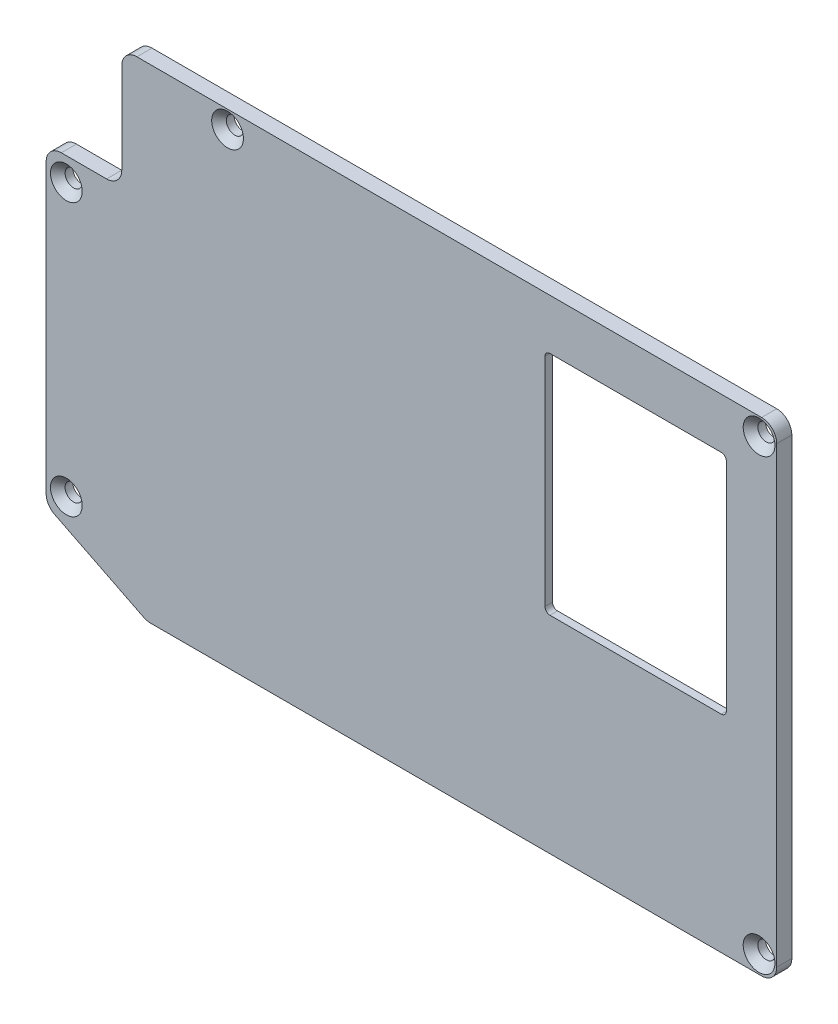
from build123d import *

# Parameters (mm, degrees)
EXTRUDE_1_DEPTH             = 3
HOLE_WIZARD_M3_1_AT_2_COUNT = 2
HOLE_WIZARD_M3_1_AT_2_PITCH = 89
HOLE_WIZARD_M3_1_AT_3_COUNT = 2
HOLE_WIZARD_M3_1_AT_3_PITCH = 139.767316539
HOLE_WIZARD_M3_1_AT_4_COUNT = 2
HOLE_WIZARD_M3_1_AT_4_PITCH = 158.615198724
HOLE_WIZARD_M3_1_AT_5_COUNT = 2
HOLE_WIZARD_M3_1_AT_5_PITCH = 105.5
FILLET_1_R                  = 3
FILLET_2_R                  = 3
CUT_EXTRUDE_1_DEPTH         = 1.2
SKETCH_5_W                  = 15
SKETCH_5_H                  = 88
CUT_EXTRUDE_2_DEPTH         = 0.8
FILLET_5_R                  = 3
FILLET_6_R                  = 5
FILLET_7_R                  = 3
SKETCH_6_W                  = 1
SKETCH_6_H                  = 16
SKETCH_6_H_2                = 12
SKETCH_6_W_2                = 12
SKETCH_6_H_3                = 1
EXTRUDE_2_DEPTH             = 1
FILLET_8_R                  = 3
CHAMFER_1_SIZE              = 1
EXTRUDE_4_DEPTH             = 1.2
CUT_EXTRUDE_3_DEPTH         = 10
CUT_EXTRUDE_5_DEPTH         = 1.5
CUT_EXTRUDE_6_DEPTH         = 0.4
FILLET_9_R                  = 2
FILLET_10_R                 = 4


with BuildPart() as part:
    # 草图1 → 凸台-拉伸1 (new body)
    with BuildSketch(Plane.XY):
        Polygon((15, 96), (15, 72), (0, 72), (0, 10), (20, 0), (145, 0), (145, 96), align=None)
    extrude(amount=EXTRUDE_1_DEPTH)

    # 草图2 → M3 平头机械螺钉的锥形沉头孔1 (revolve, cut)
    with BuildSketch(Plane(origin=(141.5, 92.5, 3), x_dir=(0, -1, 0), z_dir=(1, 0, 0))):
        Polygon((0, 0), (0, 3), (1.7, 3), (1.7, 1.45), (3.15, 0), align=None)
    hole_wizard_m3_1 = revolve(axis=Axis((141.5, 92.5, 9.35), (0, 0, -1)), mode=Mode.SUBTRACT)

    # M3 平头机械螺钉的锥形沉头孔1 at 2: M3 平头机械螺钉的锥形沉头孔1 ×2
    with Locations(*[(0, -i * HOLE_WIZARD_M3_1_AT_2_PITCH, 0) for i in range(1, HOLE_WIZARD_M3_1_AT_2_COUNT)]):
        add(hole_wizard_m3_1, mode=Mode.SUBTRACT)

    # M3 平头机械螺钉的锥形沉头孔1 at 3: M3 平头机械螺钉的锥形沉头孔1 ×2
    with Locations(*[Vector(-0.9837779203696774, -0.1793906446644101, 0) * (i * HOLE_WIZARD_M3_1_AT_3_PITCH) for i in range(1, HOLE_WIZARD_M3_1_AT_3_COUNT)]):
        add(hole_wizard_m3_1, mode=Mode.SUBTRACT)

    # M3 平头机械螺钉的锥形沉头孔1 at 4: M3 平头机械螺钉的锥形沉头孔1 ×2
    with Locations(*[Vector(-0.8668778345720617, -0.4985206313961874, 0) * (i * HOLE_WIZARD_M3_1_AT_4_PITCH) for i in range(1, HOLE_WIZARD_M3_1_AT_4_COUNT)]):
        add(hole_wizard_m3_1, mode=Mode.SUBTRACT)

    # M3 平头机械螺钉的锥形沉头孔1 at 5: M3 平头机械螺钉的锥形沉头孔1 ×2
    with Locations(*[(-i * HOLE_WIZARD_M3_1_AT_5_PITCH, 0, 0) for i in range(1, HOLE_WIZARD_M3_1_AT_5_COUNT)]):
        add(hole_wizard_m3_1, mode=Mode.SUBTRACT)

    # 圆角1
    fillet_1_edges = [part.edges().sort_by_distance(p)[0] for p in [
        (145, 0, 1.5),
        (145, 96, 1.5),
    ]]
    fillet(fillet_1_edges, radius=FILLET_1_R)

    # 圆角2
    fillet_2_edges = [part.edges().sort_by_distance(p)[0] for p in [
        (20, 0, 1.5),
        (0, 10, 1.5),
        (0, 72, 1.5),
        (15, 96, 1.5),
    ]]
    fillet(fillet_2_edges, radius=FILLET_2_R)

    # 草图4 → 切除-拉伸1 (cut)
    with BuildSketch(Plane(origin=(0, 0, 0), x_dir=(-1, 0, 0), z_dir=(0, 0, -1))):
        Polygon((-133.585786438, 92), (-141, 84.585786438), (-141, 12.121320344), (-132.878679656, 4), (-22.062305899, 4), (-13, 8.531152949), (-13, 24), (-4, 27), (-4, 50.47410222), (-19.5, 68.946282906), (-19.5, 91), (-27.171572875, 91), (-32.171572875, 86), (-39.828427125, 86), (-45.828427125, 92), align=None)
    extrude(amount=-CUT_EXTRUDE_1_DEPTH, mode=Mode.SUBTRACT)

    # 草图5 → 切除-拉伸2 (cut)
    with BuildSketch(Plane(origin=(0, 0, 1.2), x_dir=(-1, 0, 0), z_dir=(0, 0, -1))):
        with Locations((-85.5, 48)):
            Rectangle(SKETCH_5_W, SKETCH_5_H)
    extrude(amount=-CUT_EXTRUDE_2_DEPTH, mode=Mode.SUBTRACT)

    # 圆角5
    fillet_5_edges = [part.edges().sort_by_distance(p)[0] for p in [
        (13, 8.531152949, 0.6),
        (22.062305899, 4, 0.6),
        (132.878679656, 4, 0.6),
        (141, 12.121320344, 0.6),
        (141, 84.585786438, 0.6),
        (133.585786438, 92, 0.6),
        (4, 50.47410222, 0.6),
        (4, 27, 0.6),
        (45.828427125, 92, 0.6),
        (27.171572875, 91, 0.6),
        (19.5, 91, 0.6),
    ]]
    fillet(fillet_5_edges, radius=FILLET_5_R)

    # 圆角6
    fillet_6_edges = [part.edges().sort_by_distance(p)[0] for p in [
        (39.828427125, 86, 0.6),
        (32.171572875, 86, 0.6),
        (19.5, 68.946282906, 0.6),
        (13, 24, 0.6),
    ]]
    fillet(fillet_6_edges, radius=FILLET_6_R)

    # 圆角7
    fillet_7_edges = [part.edges().sort_by_distance(p)[0] for p in [
        (78, 4, 1.6),
        (93, 4, 1.6),
        (78, 92, 1.6),
        (93, 92, 1.6),
    ]]
    fillet(fillet_7_edges, radius=FILLET_7_R)

    # 草图6 → 凸台-拉伸2 (add)
    with BuildSketch(Plane(origin=(0, 0, 0), x_dir=(-1, 0, 0), z_dir=(0, 0, -1))):
        with Locations((-141.5, 48)):
            Rectangle(SKETCH_6_W, SKETCH_6_H)
        with Locations((-3.5, 40)):
            Rectangle(SKETCH_6_W, SKETCH_6_H_2)
        with Locations((-76, 3.5)):
            Rectangle(SKETCH_6_W_2, SKETCH_6_H_3)
        with Locations((-76, 92.5)):
            Rectangle(SKETCH_6_W_2, SKETCH_6_H_3)
    extrude(amount=EXTRUDE_2_DEPTH)

    # 圆角8
    fillet_8_edges = [part.edges().sort_by_distance(p)[0] for p in [
        (15, 72, 1.5),
    ]]
    fillet(fillet_8_edges, radius=FILLET_8_R)

    # 倒角1
    chamfer_1_edges = [part.edges().sort_by_distance(p)[0] for p in [
        (3.5, 46, -1),
        (3.5, 34, -1),
        (70, 3.5, -1),
        (82, 3.5, -1),
        (141.5, 56, -1),
        (141.5, 40, -1),
        (82, 92.5, -1),
        (70, 92.5, -1),
    ]]
    chamfer(chamfer_1_edges, length=CHAMFER_1_SIZE - 0.0001)  # a hair under: the kernel refuses the full size

    # 草图9 → 凸台-拉伸4 (add)
    with BuildSketch(Plane(origin=(0, 0, 1.2), x_dir=(-1, 0, 0), z_dir=(0, 0, -1))):
        with BuildLine():
            Line((-95, 92), (-95, 34))
            Line((-95, 34), (-141, 34))
            Line((-141, 34), (-141, 83.343145751))
            ThreePointArc((-141, 83.343145751), (-140.771638598, 84.491196048), (-140.121320344, 85.464466094))
            Line((-140.121320344, 85.464466094), (-134.464466094, 91.121320344))
            ThreePointArc((-134.464466094, 91.121320344), (-133.491196048, 91.771638598), (-132.343145751, 92))
            Line((-132.343145751, 92), (-95, 92))
        make_face()
    extrude(amount=EXTRUDE_4_DEPTH)

    # 草图7 → 切除-拉伸3 (cut)
    with BuildSketch(Plane.XY.offset(3)):
        with BuildLine():
            Line((100, 86), (134, 86))
            ThreePointArc((134, 86), (134.707106781, 85.707106781), (135, 85))
            Line((135, 85), (135, 42))
            ThreePointArc((135, 42), (134.707106781, 41.292893219), (134, 41))
            Line((134, 41), (100, 41))
            ThreePointArc((100, 41), (99.292893219, 41.292893219), (99, 42))
            Line((99, 42), (99, 85))
            ThreePointArc((99, 85), (99.292893219, 85.707106781), (100, 86))
        make_face()
    extrude(amount=-CUT_EXTRUDE_3_DEPTH, mode=Mode.SUBTRACT)

    # 草图10 → 切除-拉伸5 (cut)
    with BuildSketch(Plane(origin=(0, 0, 0), x_dir=(-1, 0, 0), z_dir=(0, 0, -1))):
        with BuildLine():
            Line((-135, 89), (-99, 89))
            ThreePointArc((-99, 89), (-96.878679656, 88.121320344), (-96, 86))
            Line((-96, 86), (-96, 41))
            ThreePointArc((-96, 41), (-96.878679656, 38.878679656), (-99, 38))
            Line((-99, 38), (-135, 38))
            ThreePointArc((-135, 38), (-137.121320344, 38.878679656), (-138, 41))
            Line((-138, 41), (-138, 86))
            ThreePointArc((-138, 86), (-137.121320344, 88.121320344), (-135, 89))
        make_face()
    extrude(amount=-CUT_EXTRUDE_5_DEPTH, mode=Mode.SUBTRACT)

    # 草图12 → 切除-拉伸6 (cut)
    with BuildSketch(Plane(origin=(0, 0, 1.5), x_dir=(-1, 0, 0), z_dir=(0, 0, -1))):
        with BuildLine():
            Line((-135, 38), (-99, 38))
            ThreePointArc((-99, 38), (-96.878679656, 38.878679656), (-96, 41))
            Line((-96, 41), (-96, 86))
            ThreePointArc((-96, 86), (-96.878679656, 88.121320344), (-99, 89))
            Line((-99, 89), (-135, 89))
            ThreePointArc((-135, 89), (-137.121320344, 88.121320344), (-138, 86))
            Line((-138, 86), (-138, 41))
            ThreePointArc((-138, 41), (-137.121320344, 38.878679656), (-135, 38))
        make_face()
        with BuildLine():
            Line((-135, 39.5), (-99, 39.5))
            ThreePointArc((-99, 39.5), (-97.939339828, 39.939339828), (-97.5, 41))
            Line((-97.5, 41), (-97.5, 86))
            ThreePointArc((-97.5, 86), (-97.939339828, 87.060660172), (-99, 87.5))
            Line((-99, 87.5), (-135, 87.5))
            ThreePointArc((-135, 87.5), (-136.060660172, 87.060660172), (-136.5, 86))
            Line((-136.5, 86), (-136.5, 41))
            ThreePointArc((-136.5, 41), (-136.060660172, 39.939339828), (-135, 39.5))
        make_face(mode=Mode.SUBTRACT)
    extrude(amount=-CUT_EXTRUDE_6_DEPTH, mode=Mode.SUBTRACT)

    # 圆角9
    fillet_9_edges = [part.edges().sort_by_distance(p)[0] for p in [
        (141, 34, 0.6),
        (95, 92, 0.6),
    ]]
    fillet(fillet_9_edges, radius=FILLET_9_R)

    # 圆角10
    fillet_10_edges = [part.edges().sort_by_distance(p)[0] for p in [
        (95, 34, 0.6),
    ]]
    fillet(fillet_10_edges, radius=FILLET_10_R)


solid = part.part
